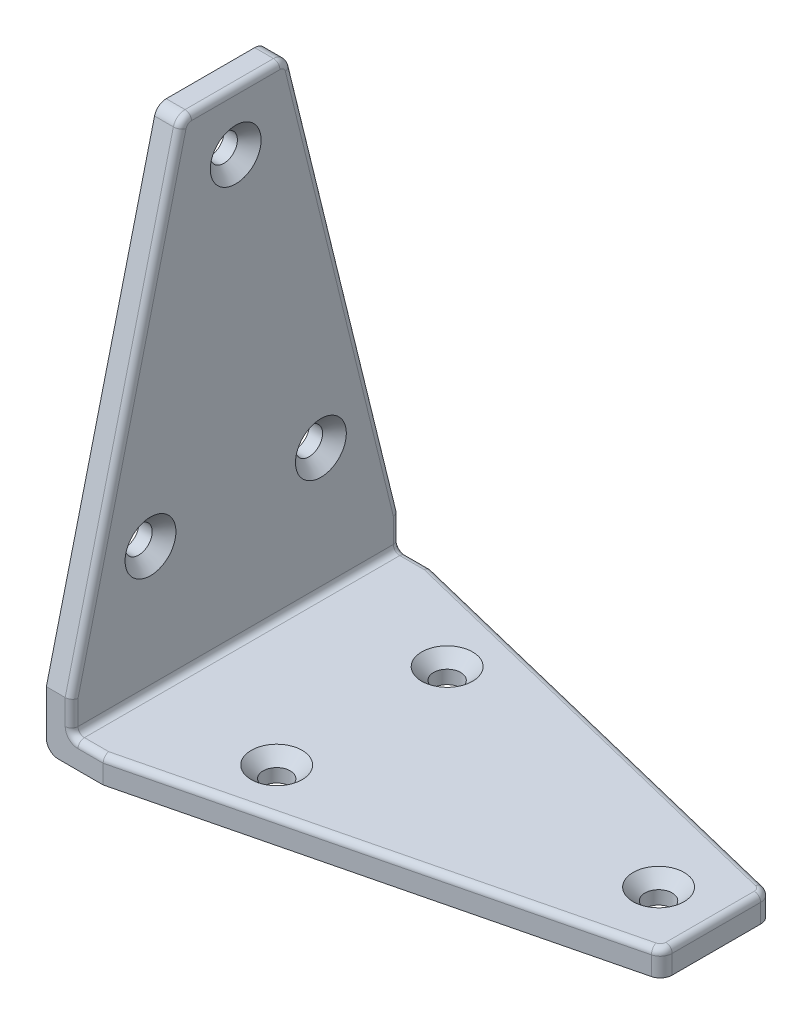
from build123d import *

# Parameters (mm, degrees)
EXTRUDE_THIN2_DEPTH = 25.9953125
CUT_EXTRUDE1_DEPTH  = 114.59781347
CUT_EXTRUDE2_DEPTH  = 114.59781347
SKETCH5_R           = 2.15
CUT_EXTRUDE4_DEPTH  = 114.59781347
SKETCH4_R           = 2.15
CUT_EXTRUDE3_DEPTH  = 114.59781347
FILLET1_R           = 1.016
FILLET2_R           = 1.905
CHAMFER1_SIZE       = 1.8796


with BuildPart() as part:
    # Sketch1 → Extrude-Thin2 (new, symmetric)
    with BuildSketch(Plane.XY):
        with BuildLine():
            Line((80.16875, 0), (1.905, 0))
            ThreePointArc((1.905, 0), (0.557961582, 0.557961582), (0, 1.905))
            Line((0, 1.905), (0, 80.16875))
            Line((0, 80.16875), (4, 80.16875))
            Line((4, 80.16875), (4, 4))
            Line((4, 4), (80.16875, 4))
            Line((80.16875, 4), (80.16875, 0))
        make_face()
    extrude(amount=EXTRUDE_THIN2_DEPTH, both=True)

    # Sketch2 → Cut-Extrude1 (cut, through all)
    with BuildSketch(Plane(origin=(4, 0, 0), x_dir=(0, 0, -1), z_dir=(1, 0, 0))):
        Polygon((-8.5, 80.16875), (8.5, 80.16875), (25.9953125, 9), (38.1, 9), (38.1, 105.56875), (-38.1, 105.56875), (-38.1, 9), (-25.9953125, 9), align=None)
    extrude(amount=-CUT_EXTRUDE1_DEPTH, mode=Mode.SUBTRACT)

    # Sketch3 → Cut-Extrude2 (cut, through all)
    with BuildSketch(Plane(origin=(0, 4, 0), x_dir=(1, 0, 0), z_dir=(0, 1, 0))):
        Polygon((9, 25.9953125), (80.16875, 8.5), (80.16875, -8.5), (9, -25.9953125), (9, -38.1), (105.56875, -38.1), (105.56875, 38.1), (9, 38.1), align=None)
    extrude(amount=-CUT_EXTRUDE2_DEPTH, mode=Mode.SUBTRACT)

    # Sketch5 → Cut-Extrude4 (cut, through all)
    with BuildSketch(Plane(origin=(0, 4, 0), x_dir=(1, 0, 0), z_dir=(0, 1, 0))):
        with Locations(Location((71, 0, 0), (0, 0, 270))):
            Circle(SKETCH5_R)
        with Locations(Location((24, 13.5, 0), (0, 0, 270))):
            Circle(SKETCH5_R)
        with Locations(Location((24, -13.5, 0), (0, 0, 90))):
            Circle(SKETCH5_R)
    extrude(amount=-CUT_EXTRUDE4_DEPTH, mode=Mode.SUBTRACT)

    # Sketch4 → Cut-Extrude3 (cut, through all)
    with BuildSketch(Plane(origin=(4, 0, 0), x_dir=(0, 0, -1), z_dir=(1, 0, 0))):
        with Locations((0, 71)):
            Circle(SKETCH4_R)
        with Locations((-13.5, 24)):
            Circle(SKETCH4_R)
        with Locations(Location((13.5, 24, 0), (0, 0, 180))):
            Circle(SKETCH4_R)
    extrude(amount=-CUT_EXTRUDE3_DEPTH, mode=Mode.SUBTRACT)

    # Fillet1
    fillet1_edges = [part.edges().sort_by_distance(p)[0] for p in [
        (6.5, 4, 25.9953125),
        (4, 4, 0),
        (4, 6.5, -25.9953125),
        (4, 6.5, 25.9953125),
        (4, 80.16875, 0),
        (4, 44.584375, 17.24765625),
        (4, 44.584375, -17.24765625),
        (80.16875, 4, 0),
        (44.584375, 4, 17.24765625),
        (44.584375, 4, -17.24765625),
        (6.5, 4, -25.9953125),
    ]]
    fillet(fillet1_edges, radius=FILLET1_R)

    # Fillet2
    # the kernel refuses this fillet: 1.905 mm, written as the material it takes off along each edge
    with BuildSketch(Plane(origin=(78.26375, 4, 7.00658656), x_dir=(0.23872121575662697, 0, 0.9710881428313695), z_dir=(-0.9710881428313695, 0, 0.23872121575662697))) as fillet2_piece_1:
        with BuildLine():
            CenterArc((0.889, -1.016), 1.016, 0, 90)
            Line((1.905, -1.016), (1.905, 0))
            Line((1.905, 0), (0.889, 0))
        make_face()
    revolve(axis=Axis((78.26375, 4, 7.00658656), (0, 1, 0)), revolution_arc=76.188922225, mode=Mode.SUBTRACT)
    with BuildSketch(Plane(origin=(4, 78.26375, 7.00658656), x_dir=(0, 1, 0), z_dir=(0, 0, -1))) as fillet2_piece_2:
        with BuildLine():
            CenterArc((0.889, -1.016), 1.016, 0, 90)
            Line((1.905, -1.016), (1.905, 0))
            Line((1.905, 0), (0.889, 0))
        make_face()
    revolve(axis=Axis((4, 78.26375, 7.00658656), (1, 0, 0)), revolution_arc=76.188922225, mode=Mode.SUBTRACT)
    with BuildSketch(Plane(origin=(4, 78.26375, -7.00658656), x_dir=(0, 0.23872121575662691, -0.9710881428313693), z_dir=(0, -0.9710881428313693, -0.23872121575662691))) as fillet2_piece_3:
        with BuildLine():
            CenterArc((0.889, -1.016), 1.016, 0, 90)
            Line((1.905, -1.016), (1.905, 0))
            Line((1.905, 0), (0.889, 0))
        make_face()
    revolve(axis=Axis((4, 78.26375, -7.00658656), (1, 0, 0)), revolution_arc=76.188922225, mode=Mode.SUBTRACT)
    with BuildSketch(Plane(origin=(78.26375, 4, -7.00658656), x_dir=(1, 0, 0), z_dir=(0, 0, 1))) as fillet2_piece_4:
        with BuildLine():
            CenterArc((0.889, -1.016), 1.016, 0, 90)
            Line((1.905, -1.016), (1.905, 0))
            Line((1.905, 0), (0.889, 0))
        make_face()
    revolve(axis=Axis((78.26375, 4, -7.00658656), (0, 1, 0)), revolution_arc=76.188922225, mode=Mode.SUBTRACT)
    with BuildSketch(Plane(origin=(4, 80.16875, 8.5), x_dir=(0, -0.971088142831369, 0.23872121575662839), z_dir=(-1, 0, 0)), Plane(origin=(80.16875, 4, 8.5), x_dir=(0, 0, -1), z_dir=(0, -1, 0))) as fillet2_piece_5:
        with BuildLine():
            CenterArc((FILLET2_R * 0.783944063022, -FILLET2_R), FILLET2_R, 90, 76.188922225)
            Line((-FILLET2_R * 0.18714407981, -FILLET2_R * 0.761278784243), (0, 0))
            Line((0, 0), (FILLET2_R * 0.783944063022, 0))
        make_face()
    extrude(amount=7.7335336, mode=Mode.SUBTRACT)
    with BuildSketch(Plane(origin=(4, 80.16875, -8.5), x_dir=(0, -0.9710881428313692, -0.23872121575662728), z_dir=(-1, 0, 0)), Plane(origin=(80.16875, 4, -8.5), x_dir=(0, 0, 1), z_dir=(0, -1, 0))) as fillet2_piece_6:
        with BuildLine():
            CenterArc((FILLET2_R * 0.783944063022, FILLET2_R), FILLET2_R, 193.811077775, 76.188922225)
            Line((-FILLET2_R * 0.18714407981, FILLET2_R * 0.761278784243), (0, 0))
            Line((0, 0), (FILLET2_R * 0.783944063022, 0))
        make_face()
    extrude(amount=7.7335336, mode=Mode.SUBTRACT)

    # Chamfer1
    chamfer1_edges = [part.edges().sort_by_distance(p)[0] for p in [
        (71, 4, -2.15),
        (24, 4, -15.65),
        (24, 4, 15.65),
        (4, 71, 2.15),
        (4, 24, 15.65),
        (4, 24, -15.65),
    ]]
    chamfer(chamfer1_edges, length=CHAMFER1_SIZE)


solid = part.part
